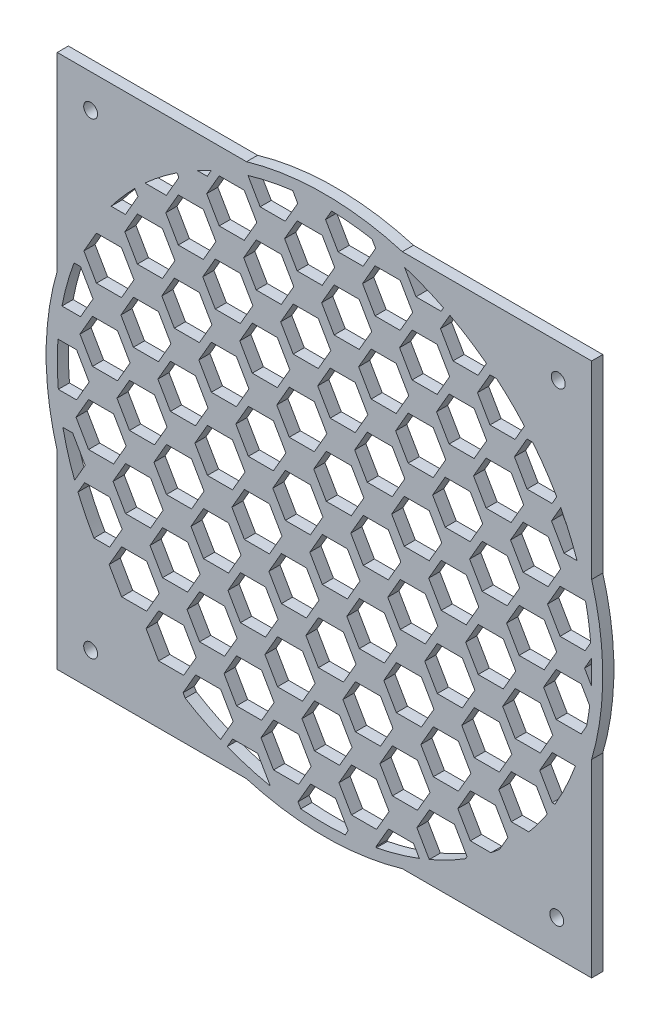
from build123d import *

# Parameters (mm, degrees)
BOSS_EXTRUDE1_DEPTH = 2.54
BOSS_EXTRUDE2_START = -2.54
SKETCH2_R           = 63.5
SKETCH2_R_2         = 60.96
BOSS_EXTRUDE2_DEPTH = 2.54
BOSS_EXTRUDE3_START = -2.54
SKETCH4_R           = 1.5875
BOSS_EXTRUDE3_DEPTH = 2.54


with BuildPart() as part:
    # Sketch1 → Boss-Extrude1 (new body)
    with BuildSketch(Plane.XY):
        with BuildLine():
            Line((-25.789750451, 55.235951804), (-26.7335, 53.601329635))
            Line((-26.7335, 53.601329635), (-29.034790535, 53.601329635))
            ThreePointArc((-29.034790535, 53.601329635), (-31.366040395, 52.271341191), (-33.636488086, 50.840026251))
            Line((-33.636488086, 50.840026251), (-33.214559246, 50.109224064))
            Line((-33.214559246, 50.109224064), (-36.072059246, 45.159888881))
            Line((-36.072059246, 45.159888881), (-40.947601105, 45.159888881))
            ThreePointArc((-40.947601105, 45.159888881), (-42.129116016, 44.059722919), (-43.28108321, 42.928655187))
            Line((-43.28108321, 42.928655187), (-42.553118492, 41.66778331))
            Line((-42.553118492, 41.66778331), (-45.410618492, 36.718448127))
            Line((-45.410618492, 36.718448127), (-48.660838126, 36.718448127))
            ThreePointArc((-48.660838126, 36.718448127), (-53.450018681, 29.312405275), (-57.120385404, 21.292796231))
            Line((-57.120385404, 21.292796231), (-55.646296231, 21.292796231))
            Line((-55.646296231, 21.292796231), (-52.788796231, 16.343461048))
            Line((-52.788796231, 16.343461048), (-55.646296231, 11.394125866))
            Line((-55.646296231, 11.394125866), (-59.885686902, 11.394125866))
            ThreePointArc((-59.885686902, 11.394125866), (-60.443945556, 7.915241351), (-60.800281678, 4.409914724))
            Line((-60.800281678, 4.409914724), (-56.543414724, 4.409914724))
            Line((-56.543414724, 4.409914724), (-53.685914724, -0.539420459))
            Line((-53.685914724, -0.539420459), (-56.543414724, -5.488755642))
            Line((-56.543414724, -5.488755642), (-60.712397099, -5.488755642))
            ThreePointArc((-60.712397099, -5.488755642), (-60.292572088, -8.995963039), (-59.670316738, -12.472966784))
            Line((-59.670316738, -12.472966784), (-57.440533216, -12.472966784))
            Line((-57.440533216, -12.472966784), (-54.583033216, -17.422301967))
            Line((-54.583033216, -17.422301967), (-57.001003505, -21.610349359))
            ThreePointArc((-57.001003505, -21.610349359), (-56.62418789, -22.579259194), (-56.230904009, -23.541602203))
            Line((-56.230904009, -23.541602203), (-54.714092462, -20.914407538))
            Line((-54.714092462, -20.914407538), (-48.999092462, -20.914407538))
            Line((-48.999092462, -20.914407538), (-46.141592462, -25.86374272))
            Line((-46.141592462, -25.86374272), (-48.999092462, -30.813077903))
            Line((-48.999092462, -30.813077903), (-52.5991999, -30.813077903))
            ThreePointArc((-52.5991999, -30.813077903), (-43.493232539, -42.713701822), (-31.759223543, -52.033386589))
            Line((-31.759223543, -52.033386589), (-32.247270201, -51.188064982))
            Line((-32.247270201, -51.188064982), (-29.389770201, -46.238729799))
            Line((-29.389770201, -46.238729799), (-23.674770201, -46.238729799))
            Line((-23.674770201, -46.238729799), (-20.817270201, -51.188064982))
            Line((-20.817270201, -51.188064982), (-23.674770201, -56.137400164))
            Line((-23.674770201, -56.137400164), (-23.763709786, -56.137400164))
            ThreePointArc((-23.763709786, -56.137400164), (-22.966684107, -56.468159357), (-22.16505627, -56.787603229))
            Line((-22.16505627, -56.787603229), (-20.948329447, -54.680170553))
            Line((-20.948329447, -54.680170553), (-15.233329447, -54.680170553))
            Line((-15.233329447, -54.680170553), (-12.375829447, -59.629505736))
            Line((-12.375829447, -59.629505736), (-12.407295422, -59.684006403))
            ThreePointArc((-12.407295422, -59.684006403), (-8.916633671, -60.3043551), (-5.395811958, -60.720728037))
            Line((-5.395811958, -60.720728037), (-6.025829447, -59.629505736))
            Line((-6.025829447, -59.629505736), (-3.168329447, -54.680170553))
            Line((-3.168329447, -54.680170553), (2.546670553, -54.680170553))
            Line((2.546670553, -54.680170553), (5.404170553, -59.629505736))
            Line((5.404170553, -59.629505736), (4.742686615, -60.775229524))
            ThreePointArc((4.742686615, -60.775229524), (8.311179289, -60.390776604), (11.850861241, -59.796978919))
            Line((11.850861241, -59.796978919), (11.754170553, -59.629505736))
            Line((11.754170553, -59.629505736), (14.611670553, -54.680170553))
            Line((14.611670553, -54.680170553), (20.326670553, -54.680170553))
            Line((20.326670553, -54.680170553), (21.656491797, -56.983488512))
            ThreePointArc((21.656491797, -56.983488512), (22.789529659, -56.539888025), (23.913487846, -56.073761235))
            Line((23.913487846, -56.073761235), (21.092729799, -51.188064982))
            Line((21.092729799, -51.188064982), (23.950229799, -46.238729799))
            Line((23.950229799, -46.238729799), (29.665229799, -46.238729799))
            Line((29.665229799, -46.238729799), (32.522729799, -51.188064982))
            Line((32.522729799, -51.188064982), (32.186733287, -51.770028011))
            ThreePointArc((32.186733287, -51.770028011), (35.134151037, -49.816794667), (37.963364655, -47.695959411))
            Line((37.963364655, -47.695959411), (33.288789045, -47.695959411))
            Line((33.288789045, -47.695959411), (30.431289045, -42.746624228))
            Line((30.431289045, -42.746624228), (33.288789045, -37.797289045))
            Line((33.288789045, -37.797289045), (39.003789045, -37.797289045))
            Line((39.003789045, -37.797289045), (41.861289045, -42.746624228))
            Line((41.861289045, -42.746624228), (39.964260225, -46.032374527))
            ThreePointArc((39.964260225, -46.032374527), (43.43408497, -42.773845546), (46.639086237, -39.254518657))
            Line((46.639086237, -39.254518657), (42.627348292, -39.254518657))
            Line((42.627348292, -39.254518657), (39.769848292, -34.305183474))
            Line((39.769848292, -34.305183474), (42.627348292, -29.355848292))
            Line((42.627348292, -29.355848292), (48.342348292, -29.355848292))
            Line((48.342348292, -29.355848292), (50.82600595, -33.657669545))
            ThreePointArc((50.82600595, -33.657669545), (51.732158535, -32.247563835), (52.5991999, -30.813077903))
            Line((52.5991999, -30.813077903), (51.965907538, -30.813077903))
            Line((51.965907538, -30.813077903), (49.108407538, -25.86374272))
            Line((49.108407538, -25.86374272), (51.965907538, -20.914407538))
            Line((51.965907538, -20.914407538), (57.260013599, -20.914407538))
            ThreePointArc((57.260013599, -20.914407538), (58.710350385, -16.407813922), (59.8065903, -11.80226066))
            Line((59.8065903, -11.80226066), (58.57802603, -13.930196395))
            Line((58.57802603, -13.930196395), (52.86302603, -13.930196395))
            Line((52.86302603, -13.930196395), (50.00552603, -8.980861213))
            Line((50.00552603, -8.980861213), (52.86302603, -4.03152603))
            Line((52.86302603, -4.03152603), (58.57802603, -4.03152603))
            Line((58.57802603, -4.03152603), (60.511565804, -7.380515157))
            ThreePointArc((60.511565804, -7.380515157), (60.73003327, -5.290052835), (60.876304295, -3.193301647))
            Line((60.876304295, -3.193301647), (59.344085276, -0.539420459))
            Line((59.344085276, -0.539420459), (60.920606274, 2.191194008))
            ThreePointArc((60.920606274, 2.191194008), (60.849402306, 3.670400384), (60.742287206, 5.147440621))
            Line((60.742287206, 5.147440621), (59.475144523, 2.952685112))
            Line((59.475144523, 2.952685112), (53.760144523, 2.952685112))
            Line((53.760144523, 2.952685112), (50.902644523, 7.902020295))
            Line((50.902644523, 7.902020295), (53.760144523, 12.851355477))
            Line((53.760144523, 12.851355477), (59.475144523, 12.851355477))
            Line((59.475144523, 12.851355477), (59.657043674, 12.536296906))
            ThreePointArc((59.657043674, 12.536296906), (58.763277134, 16.217239607), (57.642622224, 19.83556662))
            Line((57.642622224, 19.83556662), (54.657263015, 19.83556662))
            Line((54.657263015, 19.83556662), (51.799763015, 24.784901802))
            Line((51.799763015, 24.784901802), (53.914862139, 28.448360947))
            ThreePointArc((53.914862139, 28.448360947), (53.462502106, 29.289630735), (52.997016215, 30.123709472))
            Line((52.997016215, 30.123709472), (51.930822261, 28.277007373))
            Line((51.930822261, 28.277007373), (46.215822261, 28.277007373))
            Line((46.215822261, 28.277007373), (43.358322261, 33.226342556))
            Line((43.358322261, 33.226342556), (46.215822261, 38.175677739))
            Line((46.215822261, 38.175677739), (47.52619519, 38.175677739))
            ThreePointArc((47.52619519, 38.175677739), (46.591134083, 39.311421049), (45.628938514, 40.424269568))
            Line((45.628938514, 40.424269568), (43.489381507, 36.718448127))
            Line((43.489381507, 36.718448127), (37.774381507, 36.718448127))
            Line((37.774381507, 36.718448127), (34.916881507, 41.66778331))
            Line((34.916881507, 41.66778331), (37.774381507, 46.617118492))
            Line((37.774381507, 46.617118492), (39.280604164, 46.617118492))
            ThreePointArc((39.280604164, 46.617118492), (38.132821209, 47.560588166), (36.96238567, 48.475804744))
            Line((36.96238567, 48.475804744), (35.047940754, 45.159888881))
            Line((35.047940754, 45.159888881), (29.332940754, 45.159888881))
            Line((29.332940754, 45.159888881), (26.475440754, 50.109224064))
            Line((26.475440754, 50.109224064), (28.620104562, 53.823890744))
            ThreePointArc((28.620104562, 53.823890744), (27.895970376, 54.202734588), (27.166822489, 54.571836655))
            Line((27.166822489, 54.571836655), (26.6065, 53.601329635))
            Line((26.6065, 53.601329635), (20.8915, 53.601329635))
            Line((20.8915, 53.601329635), (18.258793764, 58.161310596))
            ThreePointArc((18.258793764, 58.161310596), (14.585700148, 59.189348292), (10.855504057, 59.985661884))
            Line((10.855504057, 59.985661884), (11.684, 58.550664817))
            Line((11.684, 58.550664817), (8.8265, 53.601329635))
            Line((8.8265, 53.601329635), (3.1115, 53.601329635))
            Line((3.1115, 53.601329635), (0.254, 58.550664817))
            Line((0.254, 58.550664817), (1.632409126, 60.938139457))
            ThreePointArc((1.632409126, 60.938139457), (-2.810289324, 60.895187609), (-7.238059988, 60.528770743))
            Line((-7.238059988, 60.528770743), (-6.096, 58.550664817))
            Line((-6.096, 58.550664817), (-8.9535, 53.601329635))
            Line((-8.9535, 53.601329635), (-14.6685, 53.601329635))
            Line((-14.6685, 53.601329635), (-17.445094436, 58.41053227))
            ThreePointArc((-17.445094436, 58.41053227), (-21.675618639, 56.97621571), (-25.789750451, 55.235951804))
        make_face()
        Polygon((-29.258710955, -42.746624228), (-32.116210955, -47.695959411), (-37.831210955, -47.695959411), (-40.688710955, -42.746624228), (-37.831210955, -37.797289045), (-32.116210955, -37.797289045), align=None, mode=Mode.SUBTRACT)
        Polygon((-37.700151708, -34.305183474), (-40.557651708, -39.254518657), (-46.272651708, -39.254518657), (-49.130151708, -34.305183474), (-46.272651708, -29.355848292), (-40.557651708, -29.355848292), align=None, mode=Mode.SUBTRACT)
        Polygon((-3.037270201, -51.188064982), (-5.894770201, -56.137400164), (-11.609770201, -56.137400164), (-14.467270201, -51.188064982), (-11.609770201, -46.238729799), (-5.894770201, -46.238729799), align=None, mode=Mode.SUBTRACT)
        Polygon((-11.478710955, -42.746624228), (-14.336210955, -47.695959411), (-20.051210955, -47.695959411), (-22.908710955, -42.746624228), (-20.051210955, -37.797289045), (-14.336210955, -37.797289045), align=None, mode=Mode.SUBTRACT)
        Polygon((-19.920151708, -34.305183474), (-22.777651708, -39.254518657), (-28.492651708, -39.254518657), (-31.350151708, -34.305183474), (-28.492651708, -29.355848292), (-22.777651708, -29.355848292), align=None, mode=Mode.SUBTRACT)
        Polygon((-2.140151708, -34.305183474), (-4.997651708, -39.254518657), (-10.712651708, -39.254518657), (-13.570151708, -34.305183474), (-10.712651708, -29.355848292), (-4.997651708, -29.355848292), align=None, mode=Mode.SUBTRACT)
        Polygon((-28.361592462, -25.86374272), (-31.219092462, -30.813077903), (-36.934092462, -30.813077903), (-39.791592462, -25.86374272), (-36.934092462, -20.914407538), (-31.219092462, -20.914407538), align=None, mode=Mode.SUBTRACT)
        Polygon((-36.803033216, -17.422301967), (-39.660533216, -22.371637149), (-45.375533216, -22.371637149), (-48.233033216, -17.422301967), (-45.375533216, -12.472966784), (-39.660533216, -12.472966784), align=None, mode=Mode.SUBTRACT)
        Polygon((-45.24447397, -8.980861213), (-48.10197397, -13.930196395), (-53.81697397, -13.930196395), (-56.67447397, -8.980861213), (-53.81697397, -4.03152603), (-48.10197397, -4.03152603), align=None, mode=Mode.SUBTRACT)
        Polygon((-27.46447397, -8.980861213), (-30.32197397, -13.930196395), (-36.03697397, -13.930196395), (-38.89447397, -8.980861213), (-36.03697397, -4.03152603), (-30.32197397, -4.03152603), align=None, mode=Mode.SUBTRACT)
        Polygon((-35.905914724, -0.539420459), (-38.763414724, -5.488755642), (-44.478414724, -5.488755642), (-47.335914724, -0.539420459), (-44.478414724, 4.409914724), (-38.763414724, 4.409914724), align=None, mode=Mode.SUBTRACT)
        Polygon((-10.581592462, -25.86374272), (-13.439092462, -30.813077903), (-19.154092462, -30.813077903), (-22.011592462, -25.86374272), (-19.154092462, -20.914407538), (-13.439092462, -20.914407538), align=None, mode=Mode.SUBTRACT)
        Polygon((-19.023033216, -17.422301967), (-21.880533216, -22.371637149), (-27.595533216, -22.371637149), (-30.453033216, -17.422301967), (-27.595533216, -12.472966784), (-21.880533216, -12.472966784), align=None, mode=Mode.SUBTRACT)
        Polygon((-1.243033216, -17.422301967), (-4.100533216, -22.371637149), (-9.815533216, -22.371637149), (-12.673033216, -17.422301967), (-9.815533216, -12.472966784), (-4.100533216, -12.472966784), align=None, mode=Mode.SUBTRACT)
        Polygon((-18.125914724, -0.539420459), (-20.983414724, -5.488755642), (-26.698414724, -5.488755642), (-29.555914724, -0.539420459), (-26.698414724, 4.409914724), (-20.983414724, 4.409914724), align=None, mode=Mode.SUBTRACT)
        Polygon((-9.68447397, -8.980861213), (-12.54197397, -13.930196395), (-18.25697397, -13.930196395), (-21.11447397, -8.980861213), (-18.25697397, -4.03152603), (-12.54197397, -4.03152603), align=None, mode=Mode.SUBTRACT)
        Polygon((-0.345914724, -0.539420459), (-3.203414724, -5.488755642), (-8.918414724, -5.488755642), (-11.775914724, -0.539420459), (-8.918414724, 4.409914724), (-3.203414724, 4.409914724), align=None, mode=Mode.SUBTRACT)
        Polygon((14.742729799, -51.188064982), (11.885229799, -56.137400164), (6.170229799, -56.137400164), (3.312729799, -51.188064982), (6.170229799, -46.238729799), (11.885229799, -46.238729799), align=None, mode=Mode.SUBTRACT)
        Polygon((6.301289045, -42.746624228), (3.443789045, -47.695959411), (-2.271210955, -47.695959411), (-5.128710955, -42.746624228), (-2.271210955, -37.797289045), (3.443789045, -37.797289045), align=None, mode=Mode.SUBTRACT)
        Polygon((15.639848292, -34.305183474), (12.782348292, -39.254518657), (7.067348292, -39.254518657), (4.209848292, -34.305183474), (7.067348292, -29.355848292), (12.782348292, -29.355848292), align=None, mode=Mode.SUBTRACT)
        Polygon((24.081289045, -42.746624228), (21.223789045, -47.695959411), (15.508789045, -47.695959411), (12.651289045, -42.746624228), (15.508789045, -37.797289045), (21.223789045, -37.797289045), align=None, mode=Mode.SUBTRACT)
        Polygon((33.419848292, -34.305183474), (30.562348292, -39.254518657), (24.847348292, -39.254518657), (21.989848292, -34.305183474), (24.847348292, -29.355848292), (30.562348292, -29.355848292), align=None, mode=Mode.SUBTRACT)
        Polygon((7.198407538, -25.86374272), (4.340907538, -30.813077903), (-1.374092462, -30.813077903), (-4.231592462, -25.86374272), (-1.374092462, -20.914407538), (4.340907538, -20.914407538), align=None, mode=Mode.SUBTRACT)
        Polygon((16.536966784, -17.422301967), (13.679466784, -22.371637149), (7.964466784, -22.371637149), (5.106966784, -17.422301967), (7.964466784, -12.472966784), (13.679466784, -12.472966784), align=None, mode=Mode.SUBTRACT)
        Polygon((24.978407538, -25.86374272), (22.120907538, -30.813077903), (16.405907538, -30.813077903), (13.548407538, -25.86374272), (16.405907538, -20.914407538), (22.120907538, -20.914407538), align=None, mode=Mode.SUBTRACT)
        Polygon((34.316966784, -17.422301967), (31.459466784, -22.371637149), (25.744466784, -22.371637149), (22.886966784, -17.422301967), (25.744466784, -12.472966784), (31.459466784, -12.472966784), align=None, mode=Mode.SUBTRACT)
        Polygon((8.09552603, -8.980861213), (5.23802603, -13.930196395), (-0.47697397, -13.930196395), (-3.33447397, -8.980861213), (-0.47697397, -4.03152603), (5.23802603, -4.03152603), align=None, mode=Mode.SUBTRACT)
        Polygon((17.434085276, -0.539420459), (14.576585276, -5.488755642), (8.861585276, -5.488755642), (6.004085276, -0.539420459), (8.861585276, 4.409914724), (14.576585276, 4.409914724), align=None, mode=Mode.SUBTRACT)
        Polygon((25.87552603, -8.980861213), (23.01802603, -13.930196395), (17.30302603, -13.930196395), (14.44552603, -8.980861213), (17.30302603, -4.03152603), (23.01802603, -4.03152603), align=None, mode=Mode.SUBTRACT)
        Polygon((35.214085276, -0.539420459), (32.356585276, -5.488755642), (26.641585276, -5.488755642), (23.784085276, -0.539420459), (26.641585276, 4.409914724), (32.356585276, 4.409914724), align=None, mode=Mode.SUBTRACT)
        Polygon((42.758407538, -25.86374272), (39.900907538, -30.813077903), (34.185907538, -30.813077903), (31.328407538, -25.86374272), (34.185907538, -20.914407538), (39.900907538, -20.914407538), align=None, mode=Mode.SUBTRACT)
        Polygon((52.096966784, -17.422301967), (49.239466784, -22.371637149), (43.524466784, -22.371637149), (40.666966784, -17.422301967), (43.524466784, -12.472966784), (49.239466784, -12.472966784), align=None, mode=Mode.SUBTRACT)
        Polygon((43.65552603, -8.980861213), (40.79802603, -13.930196395), (35.08302603, -13.930196395), (32.22552603, -8.980861213), (35.08302603, -4.03152603), (40.79802603, -4.03152603), align=None, mode=Mode.SUBTRACT)
        Polygon((52.994085276, -0.539420459), (50.136585276, -5.488755642), (44.421585276, -5.488755642), (41.564085276, -0.539420459), (44.421585276, 4.409914724), (50.136585276, 4.409914724), align=None, mode=Mode.SUBTRACT)
        Polygon((-44.347355477, 7.902020295), (-47.204855477, 2.952685112), (-52.919855477, 2.952685112), (-55.777355477, 7.902020295), (-52.919855477, 12.851355477), (-47.204855477, 12.851355477), align=None, mode=Mode.SUBTRACT)
        Polygon((-26.567355477, 7.902020295), (-29.424855477, 2.952685112), (-35.139855477, 2.952685112), (-37.997355477, 7.902020295), (-35.139855477, 12.851355477), (-29.424855477, 12.851355477), align=None, mode=Mode.SUBTRACT)
        Polygon((-43.450236985, 24.784901802), (-46.307736985, 19.83556662), (-52.022736985, 19.83556662), (-54.880236985, 24.784901802), (-52.022736985, 29.734236985), (-46.307736985, 29.734236985), align=None, mode=Mode.SUBTRACT)
        Polygon((-35.008796231, 16.343461048), (-37.866296231, 11.394125866), (-43.581296231, 11.394125866), (-46.438796231, 16.343461048), (-43.581296231, 21.292796231), (-37.866296231, 21.292796231), align=None, mode=Mode.SUBTRACT)
        Polygon((-25.670236985, 24.784901802), (-28.527736985, 19.83556662), (-34.242736985, 19.83556662), (-37.100236985, 24.784901802), (-34.242736985, 29.734236985), (-28.527736985, 29.734236985), align=None, mode=Mode.SUBTRACT)
        Polygon((-8.787355477, 7.902020295), (-11.644855477, 2.952685112), (-17.359855477, 2.952685112), (-20.217355477, 7.902020295), (-17.359855477, 12.851355477), (-11.644855477, 12.851355477), align=None, mode=Mode.SUBTRACT)
        Polygon((-17.228796231, 16.343461048), (-20.086296231, 11.394125866), (-25.801296231, 11.394125866), (-28.658796231, 16.343461048), (-25.801296231, 21.292796231), (-20.086296231, 21.292796231), align=None, mode=Mode.SUBTRACT)
        Polygon((0.551203769, 16.343461048), (-2.306296231, 11.394125866), (-8.021296231, 11.394125866), (-10.878796231, 16.343461048), (-8.021296231, 21.292796231), (-2.306296231, 21.292796231), align=None, mode=Mode.SUBTRACT)
        Polygon((-7.890236985, 24.784901802), (-10.747736985, 19.83556662), (-16.462736985, 19.83556662), (-19.320236985, 24.784901802), (-16.462736985, 29.734236985), (-10.747736985, 29.734236985), align=None, mode=Mode.SUBTRACT)
        Polygon((-34.111677739, 33.226342556), (-36.969177739, 28.277007373), (-42.684177739, 28.277007373), (-45.541677739, 33.226342556), (-42.684177739, 38.175677739), (-36.969177739, 38.175677739), align=None, mode=Mode.SUBTRACT)
        Polygon((-16.331677739, 33.226342556), (-19.189177739, 28.277007373), (-24.904177739, 28.277007373), (-27.761677739, 33.226342556), (-24.904177739, 38.175677739), (-19.189177739, 38.175677739), align=None, mode=Mode.SUBTRACT)
        Polygon((-24.773118492, 41.66778331), (-27.630618492, 36.718448127), (-33.345618492, 36.718448127), (-36.203118492, 41.66778331), (-33.345618492, 46.617118492), (-27.630618492, 46.617118492), align=None, mode=Mode.SUBTRACT)
        Polygon((1.448322261, 33.226342556), (-1.409177739, 28.277007373), (-7.124177739, 28.277007373), (-9.981677739, 33.226342556), (-7.124177739, 38.175677739), (-1.409177739, 38.175677739), align=None, mode=Mode.SUBTRACT)
        Polygon((-6.993118492, 41.66778331), (-9.850618492, 36.718448127), (-15.565618492, 36.718448127), (-18.423118492, 41.66778331), (-15.565618492, 46.617118492), (-9.850618492, 46.617118492), align=None, mode=Mode.SUBTRACT)
        Polygon((-15.434559246, 50.109224064), (-18.292059246, 45.159888881), (-24.007059246, 45.159888881), (-26.864559246, 50.109224064), (-24.007059246, 55.058559246), (-18.292059246, 55.058559246), align=None, mode=Mode.SUBTRACT)
        Polygon((2.345440754, 50.109224064), (-0.512059246, 45.159888881), (-6.227059246, 45.159888881), (-9.084559246, 50.109224064), (-6.227059246, 55.058559246), (-0.512059246, 55.058559246), align=None, mode=Mode.SUBTRACT)
        Polygon((8.992644523, 7.902020295), (6.135144523, 2.952685112), (0.420144523, 2.952685112), (-2.437355477, 7.902020295), (0.420144523, 12.851355477), (6.135144523, 12.851355477), align=None, mode=Mode.SUBTRACT)
        Polygon((26.772644523, 7.902020295), (23.915144523, 2.952685112), (18.200144523, 2.952685112), (15.342644523, 7.902020295), (18.200144523, 12.851355477), (23.915144523, 12.851355477), align=None, mode=Mode.SUBTRACT)
        Polygon((18.331203769, 16.343461048), (15.473703769, 11.394125866), (9.758703769, 11.394125866), (6.901203769, 16.343461048), (9.758703769, 21.292796231), (15.473703769, 21.292796231), align=None, mode=Mode.SUBTRACT)
        Polygon((9.889763015, 24.784901802), (7.032263015, 19.83556662), (1.317263015, 19.83556662), (-1.540236985, 24.784901802), (1.317263015, 29.734236985), (7.032263015, 29.734236985), align=None, mode=Mode.SUBTRACT)
        Polygon((36.111203769, 16.343461048), (33.253703769, 11.394125866), (27.538703769, 11.394125866), (24.681203769, 16.343461048), (27.538703769, 21.292796231), (33.253703769, 21.292796231), align=None, mode=Mode.SUBTRACT)
        Polygon((27.669763015, 24.784901802), (24.812263015, 19.83556662), (19.097263015, 19.83556662), (16.239763015, 24.784901802), (19.097263015, 29.734236985), (24.812263015, 29.734236985), align=None, mode=Mode.SUBTRACT)
        Polygon((44.552644523, 7.902020295), (41.695144523, 2.952685112), (35.980144523, 2.952685112), (33.122644523, 7.902020295), (35.980144523, 12.851355477), (41.695144523, 12.851355477), align=None, mode=Mode.SUBTRACT)
        Polygon((45.449763015, 24.784901802), (42.592263015, 19.83556662), (36.877263015, 19.83556662), (34.019763015, 24.784901802), (36.877263015, 29.734236985), (42.592263015, 29.734236985), align=None, mode=Mode.SUBTRACT)
        Polygon((53.891203769, 16.343461048), (51.033703769, 11.394125866), (45.318703769, 11.394125866), (42.461203769, 16.343461048), (45.318703769, 21.292796231), (51.033703769, 21.292796231), align=None, mode=Mode.SUBTRACT)
        Polygon((19.228322261, 33.226342556), (16.370822261, 28.277007373), (10.655822261, 28.277007373), (7.798322261, 33.226342556), (10.655822261, 38.175677739), (16.370822261, 38.175677739), align=None, mode=Mode.SUBTRACT)
        Polygon((10.786881507, 41.66778331), (7.929381507, 36.718448127), (2.214381507, 36.718448127), (-0.643118493, 41.66778331), (2.214381507, 46.617118492), (7.929381507, 46.617118492), align=None, mode=Mode.SUBTRACT)
        Polygon((28.566881507, 41.66778331), (25.709381507, 36.718448127), (19.994381507, 36.718448127), (17.136881507, 41.66778331), (19.994381507, 46.617118492), (25.709381507, 46.617118492), align=None, mode=Mode.SUBTRACT)
        Polygon((20.125440754, 50.109224064), (17.267940754, 45.159888881), (11.552940754, 45.159888881), (8.695440754, 50.109224064), (11.552940754, 55.058559246), (17.267940754, 55.058559246), align=None, mode=Mode.SUBTRACT)
        Polygon((37.008322261, 33.226342556), (34.150822261, 28.277007373), (28.435822261, 28.277007373), (25.578322261, 33.226342556), (28.435822261, 38.175677739), (34.150822261, 38.175677739), align=None, mode=Mode.SUBTRACT)
    extrude(amount=BOSS_EXTRUDE1_DEPTH)

    # Sketch2 → Boss-Extrude2 (add)
    with BuildSketch(Plane.XY.offset(2.54).offset(BOSS_EXTRUDE2_START)):
        Circle(SKETCH2_R)
        Circle(SKETCH2_R_2, mode=Mode.SUBTRACT)
    extrude(amount=BOSS_EXTRUDE2_DEPTH)

    # Sketch4 → Boss-Extrude3 (add)
    # profile 1 of 4: a face of its own
    with BuildSketch(Plane.XY.offset(2.54).offset(BOSS_EXTRUDE3_START)):
        with BuildLine():
            Line((-60.96, 17.78), (-60.96, 60.96))
            Line((-60.96, 60.96), (-17.78, 60.96))
            ThreePointArc((-17.78, 60.96), (-44.901280605, 44.901280605), (-60.96, 17.78))
        make_face()
        with Locations((-53.34, 53.34)):
            Circle(SKETCH4_R, mode=Mode.SUBTRACT)
    # profile 2 of 4: a face of its own
    with BuildSketch(Plane.XY.offset(2.54).offset(BOSS_EXTRUDE3_START)):
        with BuildLine():
            Line((-60.96, -60.96), (-17.78, -60.96))
            ThreePointArc((-17.78, -60.96), (-44.901280605, -44.901280605), (-60.96, -17.78))
            Line((-60.96, -17.78), (-60.96, -60.96))
        make_face()
        with Locations((-53.34, -53.34)):
            Circle(SKETCH4_R, mode=Mode.SUBTRACT)
    # profile 3 of 4: a face of its own
    with BuildSketch(Plane.XY.offset(2.54).offset(BOSS_EXTRUDE3_START)):
        with BuildLine():
            Line((60.96, -60.96), (60.96, -17.78))
            ThreePointArc((60.96, -17.78), (44.901280605, -44.901280605), (17.78, -60.96))
            Line((17.78, -60.96), (60.96, -60.96))
        make_face()
        with Locations((52.994085276, -52.994085276)):
            Circle(SKETCH4_R, mode=Mode.SUBTRACT)
    # profile 4 of 4: a face of its own
    with BuildSketch(Plane.XY.offset(2.54).offset(BOSS_EXTRUDE3_START)):
        with BuildLine():
            Line((60.96, 17.78), (60.96, 60.96))
            Line((60.96, 60.96), (17.78, 60.96))
            ThreePointArc((17.78, 60.96), (44.901280605, 44.901280605), (60.96, 17.78))
        make_face()
        with Locations((53.34, 53.34)):
            Circle(SKETCH4_R, mode=Mode.SUBTRACT)
    extrude(amount=BOSS_EXTRUDE3_DEPTH)


solid = part.part
